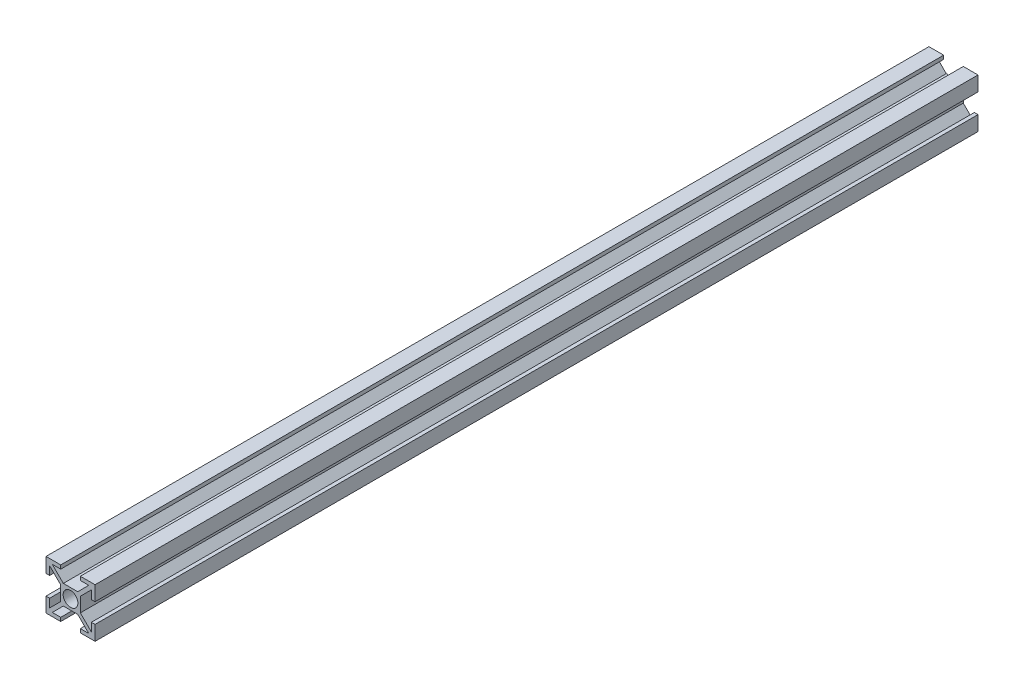
from build123d import *

# Parameters (mm, degrees)
ESBO_O1_R                = 3
RESSALTO_EXTRUS_O1_DEPTH = 360


with BuildPart() as part:
    # Esboço1 → Ressalto-extrusão1 (new body)
    with BuildSketch(Plane.XY):
        Polygon((-2.939339828, 4), (2.939339828, 4), (7.439339828, 8.5), (4, 8.5), (4, 10), (10, 10), (10, 4), (8.5, 4), (8.5, 7.439339828), (4, 2.939339828), (4, -2.939339828), (8.5, -7.439339828), (8.5, -4), (10, -4), (10, -10), (4, -10), (4, -8.5), (7.439339828, -8.5), (2.939339828, -4), (-2.939339828, -4), (-7.439339828, -8.5), (-4, -8.5), (-4, -10), (-10, -10), (-10, -4), (-8.5, -4), (-8.5, -7.439339828), (-4, -2.939339828), (-4, 2.939339828), (-8.5, 7.439339828), (-8.5, 4), (-10, 4), (-10, 10), (-4, 10), (-4, 8.5), (-7.439339828, 8.5), align=None)
        Circle(ESBO_O1_R, mode=Mode.SUBTRACT)
    extrude(amount=RESSALTO_EXTRUS_O1_DEPTH)


solid = part.part
